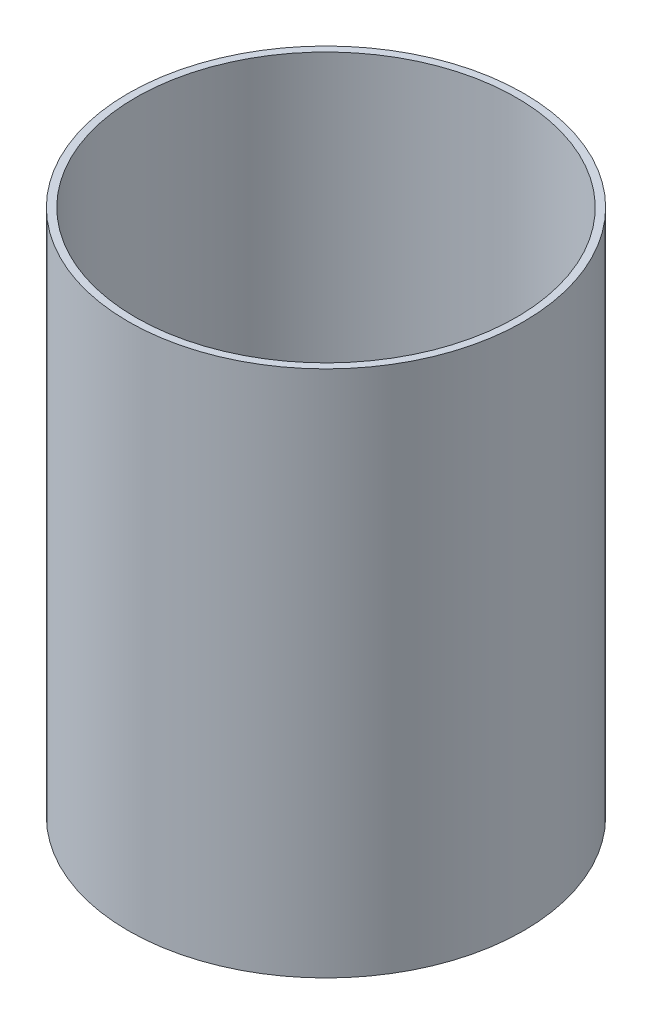
from build123d import *

# Parameters (mm, degrees)
SKETCH1_R           = 76.1746
SKETCH1_R_2         = 73.3425
BOSS_EXTRUDE1_DEPTH = 203.2


with BuildPart() as part:
    # Sketch1 → Boss-Extrude1 (new body)
    with BuildSketch(Plane(origin=(0, 0, 0), x_dir=(1, 0, 0), z_dir=(0, 1, 0))):
        Circle(SKETCH1_R)
        Circle(SKETCH1_R_2, mode=Mode.SUBTRACT)
    extrude(amount=BOSS_EXTRUDE1_DEPTH)


solid = part.part
